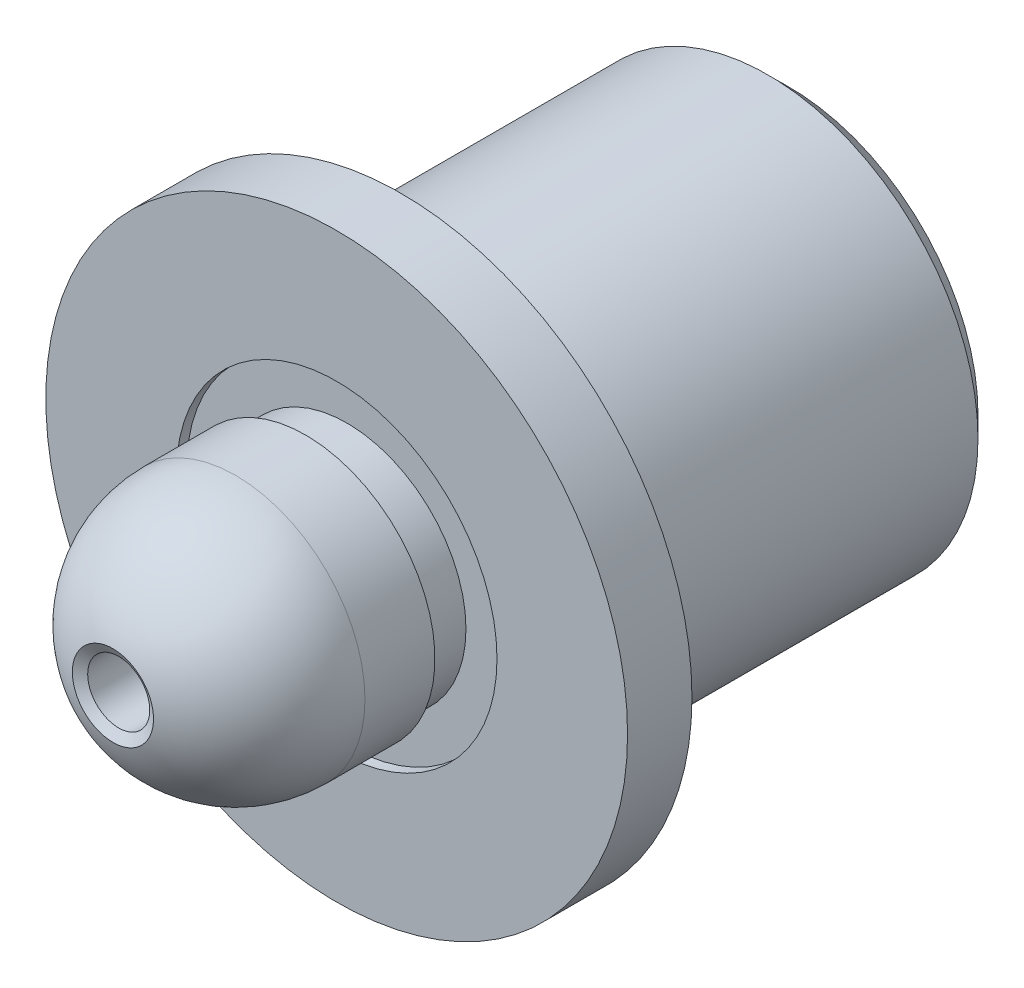
from build123d import *

# Parameters (mm, degrees)
SKETCH3_W          = 1.016
SKETCH3_H          = 1.016
CHAMFER1_SIZE      = 0.5159375
SKETCH2_R          = 0.762
CUT_EXTRUDE1_DEPTH = 2.54
CHAMFER2_SIZE      = 0.254
CHAMFER2_SIZE_2    = 0.209783356


with BuildPart() as part:
    # Sketch1 → Revolve1 (revolve)
    with BuildSketch(Plane(origin=(0, 0, 0), x_dir=(0, 0, -1), z_dir=(1, 0, 0)), mode=Mode.PRIVATE) as revolve1_sk:
        with BuildLine():
            Line((0, 0), (0, 5.159375))
            Line((0, 5.159375), (-9.525, 5.159375))
            Line((-9.525, 5.159375), (-9.525, 7.14375))
            Line((-9.525, 7.14375), (-11.10615, 7.14375))
            Line((-11.10615, 7.14375), (-11.10615, 3.175))
            Line((-11.10615, 3.175), (-13.586546081, 3.175))
            ThreePointArc((-13.586546081, 3.175), (-15.831610111, 2.24506403), (-16.761546081, 0))
            Line((-16.761546081, 0), (0, 0))
        make_face()
    revolve(revolve1_sk.sketch.rotate(Axis((0, 0, 17.430941175), (0, 0, -1)), 90), axis=Axis((0, 0, 17.430941175), (0, 0, -1)))

    # Sketch3 → Cut-Revolve1 (revolve, cut)
    with BuildSketch(Plane(origin=(0, 0, 0), x_dir=(0, 0, -1), z_dir=(1, 0, 0)), mode=Mode.PRIVATE) as cut_revolve1_sk:
        with Locations((-11.36015, 3.429)):
            Rectangle(SKETCH3_W, SKETCH3_H)
        with Locations((-9.271, 5.413375)):
            Rectangle(SKETCH3_W, SKETCH3_H)
    revolve(cut_revolve1_sk.sketch.rotate(Axis((0, 0, 17.430941175), (0, 0, -1)), 90), axis=Axis((0, 0, 17.430941175), (0, 0, -1)), mode=Mode.SUBTRACT)

    # Chamfer1
    chamfer1_edges = [part.edges().sort_by_distance(p)[0] for p in [
        (-5.159375, 0, 0),
    ]]
    chamfer(chamfer1_edges, length=CHAMFER1_SIZE)

    # Sketch2 → Cut-Extrude1 (cut)
    with BuildSketch(Plane(origin=(0, 0, 0), x_dir=(-1, 0, 0), z_dir=(0, 0, -1))):
        Circle(SKETCH2_R)
    cut_extrude1 = extrude(amount=-CUT_EXTRUDE1_DEPTH, mode=Mode.SUBTRACT)

    # Mirror1: Cut-Extrude1 across plane
    add(cut_extrude1.mirror(Plane.XY.offset(8.38077304)), mode=Mode.SUBTRACT)

    # Chamfer2
    # the kernel refuses this chamfer: 0.254, 0.209783356 mm, written as the material it takes off along each edge
    with BuildSketch(Plane(origin=(0, 0, 0), x_dir=(-1, 0, 0), z_dir=(0, -1, 0))) as chamfer2_piece_1:
        Polygon((0.762 + CHAMFER2_SIZE, 0), (0.762, -CHAMFER2_SIZE), (0.762, 0), align=None)
    revolve(axis=Axis((0, 0, 0), (0, 0, -1)), mode=Mode.SUBTRACT)
    with BuildSketch(Plane(origin=(0, 0, 16.66875), x_dir=(-1, 0, 0), z_dir=(0, 1, 0))) as chamfer2_piece_2:
        with BuildLine():
            Line((0.997154658, -0.067853643), (0.762, -CHAMFER2_SIZE_2))
            Line((0.762, -CHAMFER2_SIZE_2), (0.762, 0))
            ThreePointArc((0.762, 0), (0.883545152, -0.032618216), (0.997154658, -0.067853643))
        make_face()
    revolve(axis=Axis((0, 0, 16.66875), (0, 0, 1)), revolution_arc=180, mode=Mode.SUBTRACT)
    with BuildSketch(Plane(origin=(0, 0, 16.66875), x_dir=(1, 0, 0), z_dir=(0, -1, 0))) as chamfer2_piece_3:
        with BuildLine():
            Line((0.997154658, -0.067853643), (0.762, -CHAMFER2_SIZE_2))
            Line((0.762, -CHAMFER2_SIZE_2), (0.762, 0))
            ThreePointArc((0.762, 0), (0.883545152, -0.032618216), (0.997154658, -0.067853643))
        make_face()
    revolve(axis=Axis((0, 0, 16.66875), (0, 0, 1)), revolution_arc=180, mode=Mode.SUBTRACT)


solid = part.part
